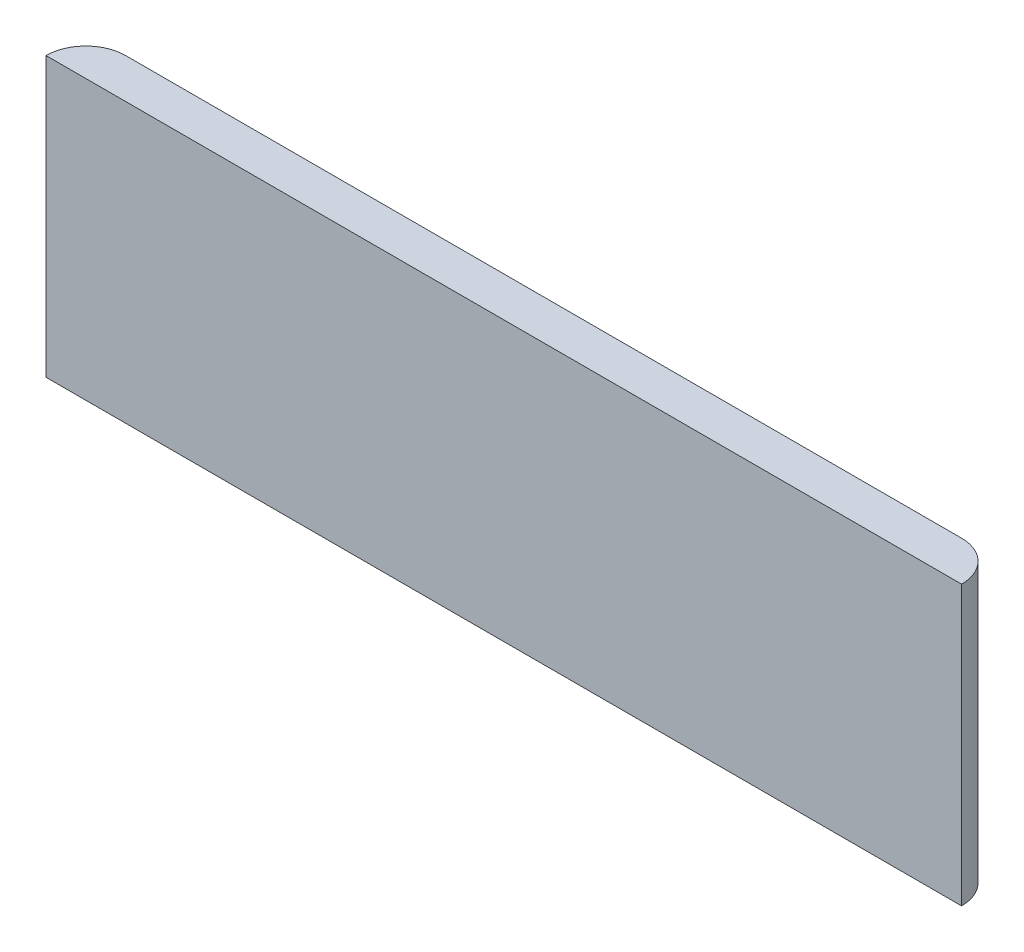
from build123d import *

# Parameters (mm, degrees)
SKETCH1_W           = 146.05
SKETCH1_H           = 6.35
BOSS_EXTRUDE1_DEPTH = 44.45
FILLET1_R           = 6.35


with BuildPart() as part:
    # Sketch1 → Boss-Extrude1 (new body)
    with BuildSketch(Plane(origin=(0, 0, 0), x_dir=(1, 0, 0), z_dir=(0, 1, 0))):
        with Locations((-73.025, -3.175)):
            Rectangle(SKETCH1_W, SKETCH1_H)
    extrude(amount=BOSS_EXTRUDE1_DEPTH)

    # Fillet1
    fillet1_edges = [part.edges().sort_by_distance(p)[0] for p in [
        (-146.05, 22.225, 0),
        (0, 22.225, 0),
    ]]
    fillet(fillet1_edges, radius=FILLET1_R - 0.0001)  # a hair under: the kernel refuses the full size


solid = part.part
